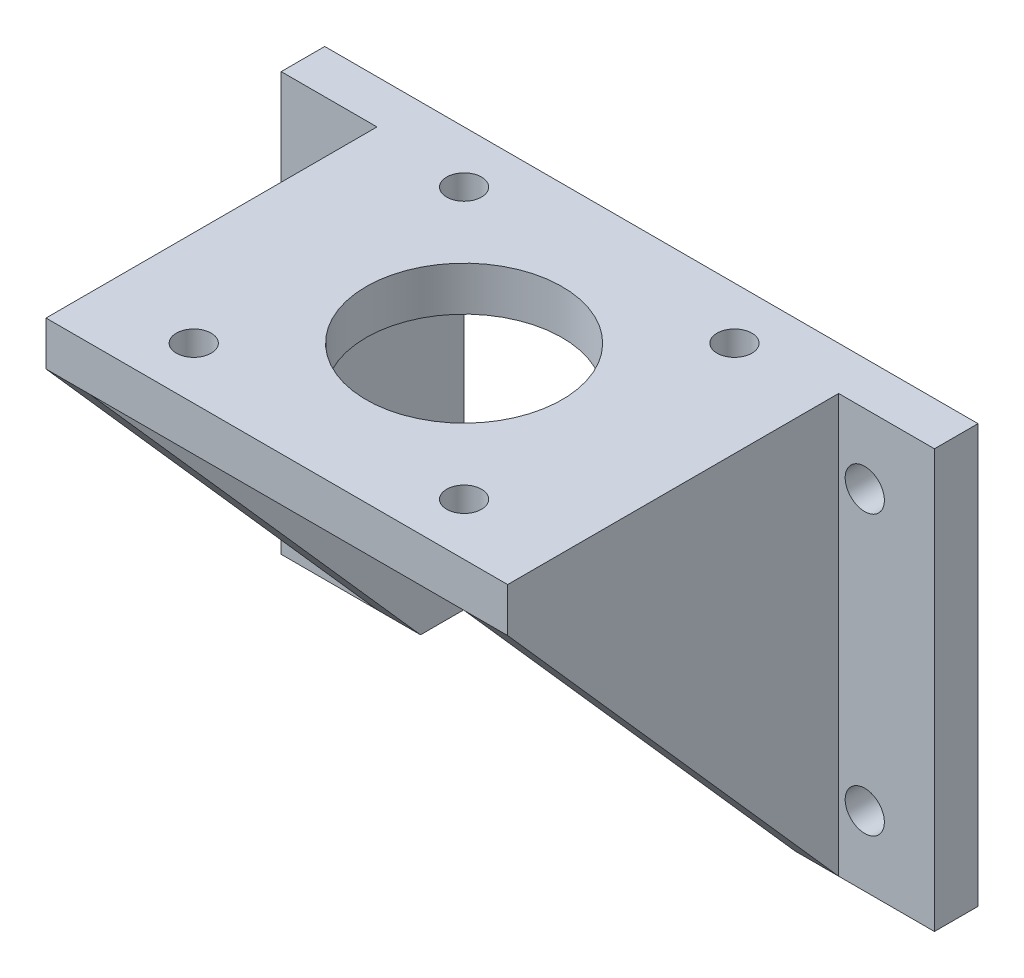
from build123d import *

# Parameters (mm, degrees)
SKETCH1_R           = 2.25
BOSS_EXTRUDE1_DEPTH = 5
SKETCH2_W           = 53
SKETCH2_H           = 5.069282957
BOSS_EXTRUDE2_DEPTH = 38
BOSS_EXTRUDE3_DEPTH = 5
BOSS_EXTRUDE4_DEPTH = 5
SKETCH5_R           = 11.25
SKETCH5_R_2         = 2
CUT_EXTRUDE1_DEPTH  = 88.372764635


with BuildPart() as part:
    # Sketch1 → Boss-Extrude1 (new body)
    with BuildSketch(Plane.XY):
        Polygon((0, 0), (0, 43), (43, 43), (43, 0), (59, 0), (59, 48), (-16, 48), (-16, 0), align=None)
        with Locations((-8, 40)):
            Circle(SKETCH1_R, mode=Mode.SUBTRACT)
        with Locations((51, 40)):
            Circle(SKETCH1_R, mode=Mode.SUBTRACT)
        with Locations((51, 8)):
            Circle(SKETCH1_R, mode=Mode.SUBTRACT)
        with Locations((-8, 8)):
            Circle(SKETCH1_R, mode=Mode.SUBTRACT)
    extrude(amount=BOSS_EXTRUDE1_DEPTH)

    # Sketch2 → Boss-Extrude2 (add)
    with BuildSketch(Plane.XY.offset(5)):
        with Locations((21.5, 45.465358522)):
            Rectangle(SKETCH2_W, SKETCH2_H)
    extrude(amount=BOSS_EXTRUDE2_DEPTH)

    # Sketch3 → Boss-Extrude3 (add)
    with BuildSketch(Plane.ZY.offset(5)):
        Polygon((5, 48), (5, 0), (43, 42.930717043), (43, 48), align=None)
    extrude(amount=-BOSS_EXTRUDE3_DEPTH)

    # Sketch4 → Boss-Extrude4 (add)
    with BuildSketch(Plane(origin=(48, 0, 0), x_dir=(0, 0, -1), z_dir=(1, 0, 0))):
        Polygon((-43, 48), (-43, 42.930717043), (-5, 0), (-5, 48), align=None)
    extrude(amount=-BOSS_EXTRUDE4_DEPTH)

    # Sketch5 → Cut-Extrude1 (cut, through all)
    with BuildSketch(Plane(origin=(0, 48, 0), x_dir=(1, 0, 0), z_dir=(0, 1, 0))):
        with Locations((21.5, -21.5)):
            Circle(SKETCH5_R)
        with Locations((5.98, -5.98)):
            Circle(SKETCH5_R_2)
        with Locations((37.02, -5.98)):
            Circle(SKETCH5_R_2)
        with Locations((37.02, -37.02)):
            Circle(SKETCH5_R_2)
        with Locations((5.98, -37.02)):
            Circle(SKETCH5_R_2)
    extrude(amount=-CUT_EXTRUDE1_DEPTH, mode=Mode.SUBTRACT)


solid = part.part
